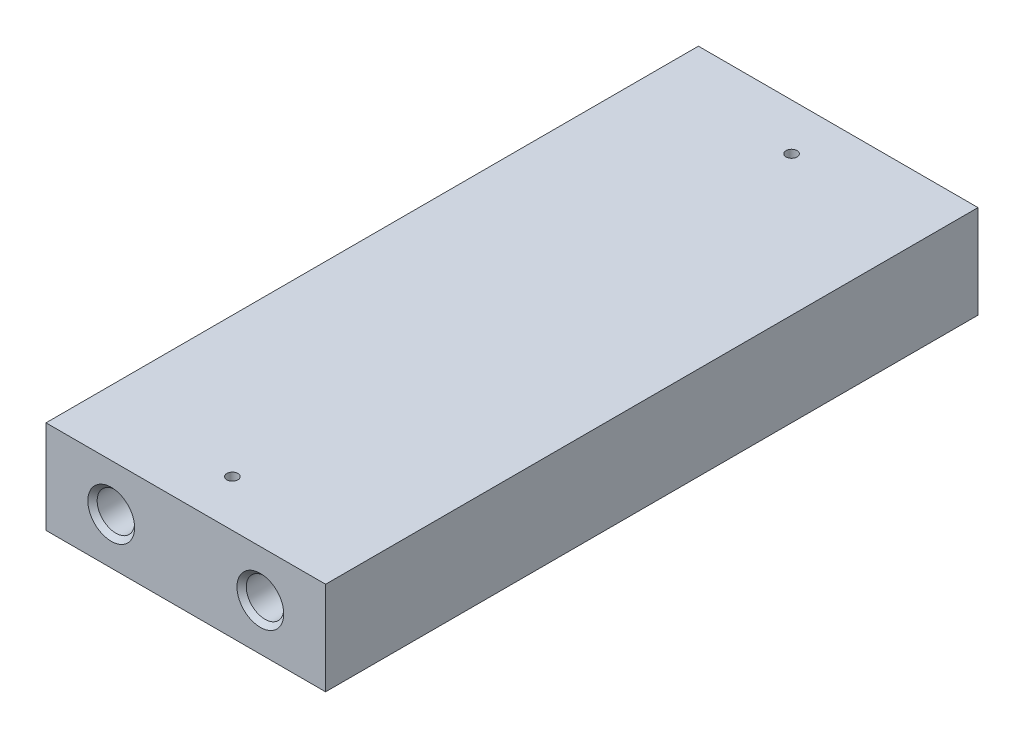
from build123d import *

# Parameters (mm, degrees)
SKETCH1_W                        = 38.1
SKETCH1_H                        = 12.7
BOSS_EXTRUDE1_DEPTH              = 88.9
F_1_4_20_TAPPED_HOLE1_AT_2_COUNT = 2
F_1_4_20_TAPPED_HOLE1_AT_2_PITCH = 20.32
F_1_64_TAPPED_HOLE1_D            = 1.5113


with BuildPart() as part:
    # Sketch1 → Boss-Extrude1 (new body)
    with BuildSketch(Plane.XY):
        Rectangle(SKETCH1_W, SKETCH1_H)
    extrude(amount=-BOSS_EXTRUDE1_DEPTH)

    # Sketch4 → 1/4-20 Tapped Hole1 (revolve, cut)
    with BuildSketch(Plane(origin=(-10.16, 0, 0), x_dir=(0, -1, 0), z_dir=(1, 0, 0))):
        Polygon((0, 0), (0, 18.043816902), (2.5527, 16.51), (2.5527, 0.635), (3.1877, 0), align=None)
    f_1_4_20_tapped_hole1 = revolve(axis=Axis((-10.16, 0, 6.35), (0, 0, -1)), mode=Mode.SUBTRACT)

    # 1/4-20 Tapped Hole1 at 2: 1/4-20 Tapped Hole1 ×2
    with Locations(*[(i * F_1_4_20_TAPPED_HOLE1_AT_2_PITCH, 0, 0) for i in range(1, F_1_4_20_TAPPED_HOLE1_AT_2_COUNT)]):
        add(f_1_4_20_tapped_hole1, mode=Mode.SUBTRACT)

    # Mirror1: 1/4-20 Tapped Hole1 across plane
    add(f_1_4_20_tapped_hole1.mirror(Plane.XY.offset(-44.45)), mode=Mode.SUBTRACT)

    # Mirror1 copy 1 sketch → Mirror1 copy 1 (revolve, cut)
    with BuildSketch(Plane(origin=(10.16, 0, -88.9), x_dir=(0, -1, 0), z_dir=(1, 0, 0))):
        Polygon((0, 0), (0, -18.043816902), (2.5527, -16.51), (2.5527, -0.635), (3.1877, 0), align=None)
    revolve(axis=Axis((10.16, 0, -95.25), (0, 0, -1)), mode=Mode.SUBTRACT)

    # #1-64 Tapped Hole1 (through all)
    with Locations(Plane(origin=(0, 6.35, -82.55), x_dir=(0, 0, 1), z_dir=(0, 1, 0))):
        with Locations((0, 0), (76.2, 0)):
            Hole(F_1_64_TAPPED_HOLE1_D / 2)


solid = part.part
